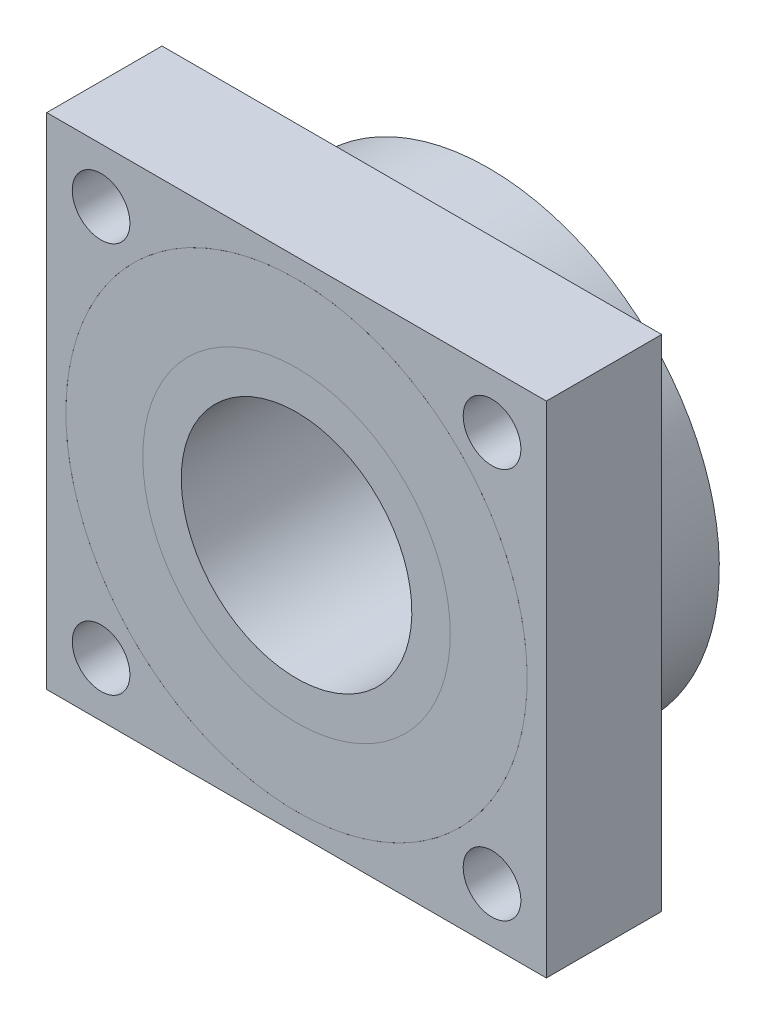
from build123d import *

# Parameters (mm, degrees)
SKETCH1_W           = 12.7
SKETCH1_H           = 5.08
SKETCH1_4_W         = 12.7
SKETCH1_4_H         = 2.54
SKETCH3_W           = 33.02
SKETCH3_H           = 33.02
SKETCH3_R           = 15.24
BOSS_EXTRUDE1_DEPTH = 7.62
SKETCH4_R           = 1.905
CUT_EXTRUDE2_DEPTH  = 25.560631099


with BuildPart() as part:
    # Sketch1 → Revolve2 (revolve)
    with BuildSketch(Plane(origin=(0, 0, 0), x_dir=(0, 0, -1), z_dir=(1, 0, 0))):
        with Locations((6.35, 12.7)):
            Rectangle(SKETCH1_W, SKETCH1_H)
    revolve(axis=Axis((0, 0, -12.7), (0, 0, 1)))


with BuildPart() as body_2:
    # Sketch1<4> → Revolve3 (revolve)
    with BuildSketch(Plane(origin=(0, 0, 0), x_dir=(0, 0, -1), z_dir=(1, 0, 0))):
        with Locations((6.35, 8.89)):
            Rectangle(SKETCH1_4_W, SKETCH1_4_H)
    revolve(axis=Axis((0, 0, -12.7), (0, 0, 1)))


with BuildPart() as body_3:
    # Sketch3 → Boss-Extrude1 (new body)
    with BuildSketch(Plane.XY):
        Rectangle(SKETCH3_W, SKETCH3_H)
        Circle(SKETCH3_R, mode=Mode.SUBTRACT)
    extrude(amount=-BOSS_EXTRUDE1_DEPTH)

    # Sketch4 → Cut-Extrude2 (cut, through all)
    with BuildSketch(Plane(origin=(0, 0, -7.62), x_dir=(-1, 0, 0), z_dir=(0, 0, -1))):
        with Locations((-12.917897552, 12.917897552)):
            Circle(SKETCH4_R)
        with Locations((12.917897552, 12.917897552)):
            Circle(SKETCH4_R)
        with Locations((12.917897552, -12.917897552)):
            Circle(SKETCH4_R)
        with Locations((-12.917897552, -12.917897552)):
            Circle(SKETCH4_R)
    extrude(amount=-CUT_EXTRUDE2_DEPTH, mode=Mode.SUBTRACT)


solid = Compound([part.part, body_2.part, body_3.part])
